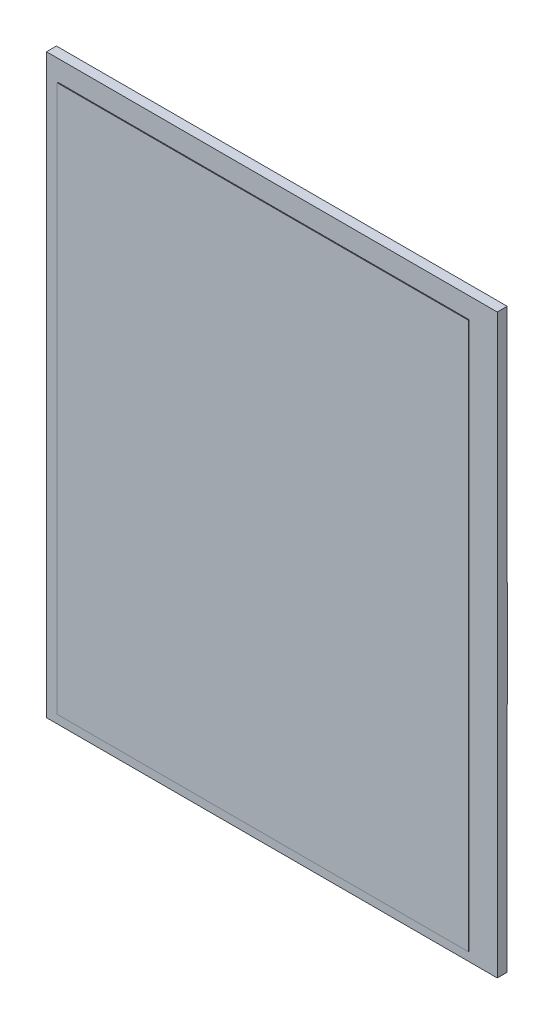
from build123d import *

# Parameters (mm, degrees)
SKETCH1_W           = 136
SKETCH1_H           = 174
BOSS_EXTRUDE1_DEPTH = 3
SKETCH2_W           = 124
SKETCH2_H           = 165
BOSS_EXTRUDE2_DEPTH = 0.25
SKETCH3_W           = 20
SKETCH3_H           = 31.75
BOSS_EXTRUDE3_DEPTH = 0.1


with BuildPart() as part:
    # Sketch1 → Boss-Extrude1 (new body)
    with BuildSketch(Plane.XY):
        Rectangle(SKETCH1_W, SKETCH1_H)
    extrude(amount=BOSS_EXTRUDE1_DEPTH)

    # Sketch2 → Boss-Extrude2 (add)
    with BuildSketch(Plane.XY.offset(3)):
        with Locations((-2.5, -1.75)):
            Rectangle(SKETCH2_W, SKETCH2_H)
    extrude(amount=BOSS_EXTRUDE2_DEPTH)

    # Sketch3 → Boss-Extrude3 (add)
    with BuildSketch(Plane(origin=(0, 0, 0), x_dir=(-1, 0, 0), z_dir=(0, 0, -1))):
        with Locations((-58, -1.125)):
            Rectangle(SKETCH3_W, SKETCH3_H)
    extrude(amount=BOSS_EXTRUDE3_DEPTH)


solid = part.part
